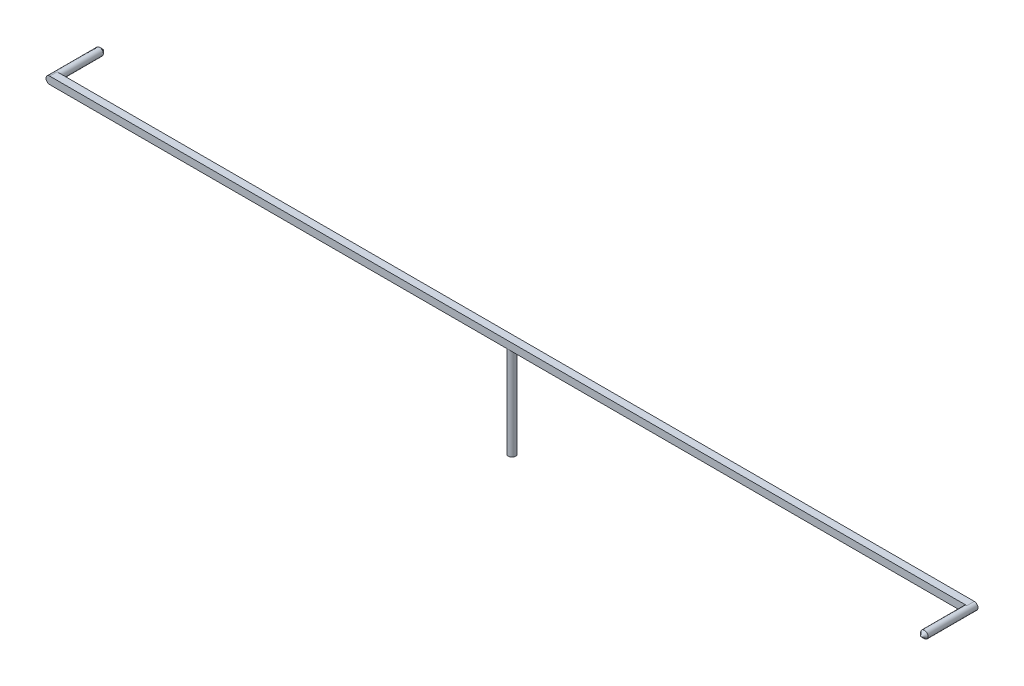
from build123d import *

# Parameters (mm, degrees)
SKETCH_1_R      = 0.4
EXTRUDE_1_DEPTH = 10
SKETCH_2_W      = 100
SKETCH_2_H      = 0.8
EXTRUDE_2_DEPTH = 0.8
FILLET_1_R      = 0.4
SKETCH_3_R      = 0.4
EXTRUDE_3_DEPTH = 5
SKETCH_4_R      = 0.4
EXTRUDE_4_DEPTH = 5
CHAMFER_1_SIZE  = 0.4


with BuildPart() as part:
    # 草图1 → 凸台-拉伸1 (new body)
    with BuildSketch(Plane(origin=(0, 0, 0), x_dir=(1, 0, 0), z_dir=(0, 1, 0))):
        with Locations(Location((0, 0, 0), (0, 0, 270))):
            Circle(SKETCH_1_R)
    extrude(amount=EXTRUDE_1_DEPTH)

    # 草图2 → 凸台-拉伸2 (add)
    with BuildSketch(Plane(origin=(0, 10, 0), x_dir=(1, 0, 0), z_dir=(0, 1, 0))):
        Rectangle(SKETCH_2_W, SKETCH_2_H)
    extrude(amount=EXTRUDE_2_DEPTH)

    # 圆角1
    fillet_1_edges = [part.edges().sort_by_distance(p)[0] for p in [
        (50, 10, 0),
        (50, 10.8, 0),
        (-50, 10, 0),
        (-50, 10.8, 0),
    ]]
    fillet(fillet_1_edges, radius=FILLET_1_R - 0.0001)  # a hair under: the kernel refuses the full size

    # 草图3 → 凸台-拉伸3 (add)
    with BuildSketch(Plane.XY.offset(0.4)):
        with Locations((49.6, 10.4)):
            Circle(SKETCH_3_R)
    extrude(amount=EXTRUDE_3_DEPTH)

    # 草图4 → 凸台-拉伸4 (add)
    with BuildSketch(Plane(origin=(0, 0, -0.4), x_dir=(-1, 0, 0), z_dir=(0, 0, -1))):
        with Locations((49.6, 10.4)):
            Circle(SKETCH_4_R)
    extrude(amount=EXTRUDE_4_DEPTH)

    # 倒角1
    chamfer_1_edges = [part.edges().sort_by_distance(p)[0] for p in [
        (49.2, 10.4, 5.4),
        (-49.2, 10.4, -5.4),
    ]]
    chamfer(chamfer_1_edges, length=CHAMFER_1_SIZE)


solid = part.part
